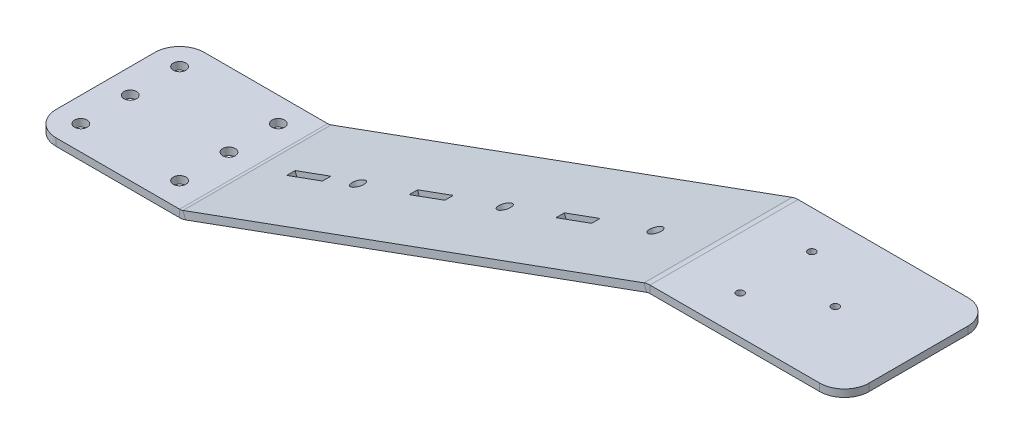
from build123d import *

# Parameters (mm, degrees)
SKETCH1_W          = 60
SKETCH1_H          = 60
BASE_FLANGE1_DEPTH = 3
EDGE_FLANGE1_DEPTH = 60
EDGE_FLANGE2_DEPTH = 60
FILLET1_R          = 10
SKETCH12_R         = 2.55
CUT_EXTRUDE1_DEPTH = 10
CAVITY1_START      = -1.5
CAVITY1_DEPTH      = 3
SKETCH15_W         = 15.4
SKETCH15_H         = 3.400000894
SKETCH15_H_2       = 3.4
CUT_EXTRUDE3_DEPTH = 3
SKETCH16_R         = 1.5
CUT_EXTRUDE4_DEPTH = 3
SKETCH17_R         = 2.55
CUT_EXTRUDE5_DEPTH = 10


# Read off the part's stored shape, not the designer's step: Cavity1
# Sheet-metal steps are written as plain solids
with BuildPart() as part:
    # Sketch1 → Base-Flange1 (new body)
    with BuildSketch(Plane(origin=(0, 0, 0), x_dir=(1, 0, 0), z_dir=(0, 1, 0))):
        Rectangle(SKETCH1_W, SKETCH1_H)
    extrude(amount=-BASE_FLANGE1_DEPTH)

    # Edge-Flange1 section (across the edge) → Edge-Flange1 (add)
    with BuildSketch(Plane(origin=(30.705307923, 0, 30), x_dir=(-0.3420201433256631, 0.9396926207859105, 0), z_dir=(0, 0, -1))):
        with BuildLine():
            Line((-3, 0.705307923), (-3, 199.471019058))
            Line((-3, 199.471019058), (0, 199.471019058))
            Line((0, 199.471019058), (0, 0.705307923))
            ThreePointArc((0, 0.705307923), (0.060768988, 0.010715212), (0.241229517, -0.66277265))
            Line((0.241229517, -0.66277265), (-2.577848346, -1.68883308))
            ThreePointArc((-2.577848346, -1.68883308), (-2.893654271, -0.510229321), (-3, 0.705307923))
        make_face()
    extrude(amount=EDGE_FLANGE1_DEPTH)

    # Edge-Flange2 section (across the edge) → Edge-Flange2 (add)
    with BuildSketch(Plane(origin=(219.835585673, 65.645258182, -30), x_dir=(0, -1, 0), z_dir=(0, 0, 1))):
        with BuildLine():
            Line((-3, 0.705307923), (-3, 79.471019058))
            Line((-3, 79.471019058), (0, 79.471019058))
            Line((0, 79.471019058), (0, 0.705307923))
            ThreePointArc((0, 0.705307923), (0.060768988, 0.010715212), (0.241229517, -0.66277265))
            Line((0.241229517, -0.66277265), (-2.577848346, -1.68883308))
            ThreePointArc((-2.577848346, -1.68883308), (-2.893654271, -0.510229321), (-3, 0.705307923))
        make_face()
    extrude(amount=EDGE_FLANGE2_DEPTH)

    # Fillet1
    fillet1_edges = [part.edges().sort_by_distance(p)[0] for p in [
        (299.30660473, 67.145258182, -30),
        (299.30660473, 67.145258182, 30),
        (-30, -1.5, 30),
        (-30, -1.5, -30),
    ]]
    fillet(fillet1_edges, radius=FILLET1_R)

    # Sketch12 → Cut-Extrude1 (cut)
    with BuildSketch(Plane(origin=(0, 0, 0), x_dir=(1, 0, 0), z_dir=(0, 1, 0))):
        with Locations(Location((20, 20, 0), (0, 0, 270))):
            Circle(SKETCH12_R)
        with Locations(Location((20, -20, 0), (0, 0, 270))):
            Circle(SKETCH12_R)
        with Locations(Location((-20, -20, 0), (0, 0, 270))):
            Circle(SKETCH12_R)
        with Locations(Location((-20, 20, 0), (0, 0, 270))):
            Circle(SKETCH12_R)
        with Locations(Location((-20, 0, 0), (0, 0, 270))):
            Circle(SKETCH12_R)
        with Locations(Location((20, 0, 0), (0, 0, 270))):
            Circle(SKETCH12_R)
    extrude(amount=-CUT_EXTRUDE1_DEPTH, mode=Mode.SUBTRACT)

    # Cavity1 outline → Cavity1 (cut)
    with BuildSketch(Plane.XY.offset(CAVITY1_START)):
        with BuildLine():
            ThreePointArc((167.585662257, 46.627841316), (168.714237544, 47.661990034), (168.781007212, 49.191266844))
            Line((168.781007212, 49.191266844), (168.438987069, 50.130959465))
            Line((168.438987069, 50.130959465), (154.343597757, 45.000657315))
            Line((154.343597757, 45.000657315), (154.6856179, 44.060964694))
            ThreePointArc((154.6856179, 44.060964694), (155.719766618, 42.932389407), (157.249043428, 42.865619739))
            Line((157.249043428, 42.865619739), (167.585662257, 46.627841316))
        make_face()
        with BuildLine():
            Line((109.317258169, 27.548232175), (108.975238025, 28.487924795))
            Line((108.975238025, 28.487924795), (94.879848713, 23.357622645))
            Line((94.879848713, 23.357622645), (95.221868857, 22.417930025))
            ThreePointArc((95.221868857, 22.417930025), (96.256017575, 21.289354737), (97.785294385, 21.22258507))
            Line((97.785294385, 21.22258507), (108.121913214, 24.984806646))
            ThreePointArc((108.121913214, 24.984806646), (109.250488501, 26.018955365), (109.317258169, 27.548232175))
        make_face()
        with BuildLine():
            Line((59.726286316, 9.498594532), (59.384266173, 10.438287153))
            Line((59.384266173, 10.438287153), (45.288876861, 5.307985003))
            Line((45.288876861, 5.307985003), (45.630897004, 4.368292382))
            ThreePointArc((45.630897004, 4.368292382), (46.665045723, 3.239717095), (48.194322533, 3.172947427))
            Line((48.194322533, 3.172947427), (58.530941361, 6.935169004))
            ThreePointArc((58.530941361, 6.935169004), (59.659516649, 7.969317722), (59.726286316, 9.498594532))
        make_face()
    extrude(amount=CAVITY1_DEPTH, mode=Mode.SUBTRACT)

    # Sketch15 → Cut-Extrude3 (cut)
    with BuildSketch(Plane(origin=(3.591838707, -9.868495742, 0), x_dir=(0.9396926207859104, 0.34202014332566316, 0), z_dir=(-0.34202014332566316, 0.9396926207859104, 0))):
        with Locations((104.646671142, 0)):
            Rectangle(SKETCH15_W, SKETCH15_H)
        with Locations((51.873061181, 0)):
            Rectangle(SKETCH15_W, SKETCH15_H)
        with Locations((167.926671142, 0)):
            Rectangle(SKETCH15_W, SKETCH15_H_2)
    extrude(amount=-CUT_EXTRUDE3_DEPTH, mode=Mode.SUBTRACT)

    # Sketch16 → Cut-Extrude4 (cut)
    with BuildSketch(Plane(origin=(0, 68.645258182, 0), x_dir=(1, 0, 0), z_dir=(0, 1, 0))):
        with Locations(Location((265.60660473, 0, 0), (0, 0, 270))):
            Circle(SKETCH16_R)
        with Locations(Location((241.60660473, 14.5, 0), (0, 0, 270))):
            Circle(SKETCH16_R)
        with Locations(Location((241.60660473, -14.5, 0), (0, 0, 270))):
            Circle(SKETCH16_R)
    extrude(amount=-CUT_EXTRUDE4_DEPTH, mode=Mode.SUBTRACT)

    # Sketch17 → Cut-Extrude5 (cut)
    with BuildSketch(Plane(origin=(3.591838707, -9.868495742, 0), x_dir=(0.9396926207859104, 0.34202014332566316, 0), z_dir=(-0.34202014332566316, 0.9396926207859104, 0))):
        with Locations(Location((136.324570332, 0, 0), (0, 0, 180))):
            Circle(SKETCH17_R)
        with Locations(Location((201.324570332, 0, 0), (0, 0, 180))):
            Circle(SKETCH17_R)
        with Locations(Location((73.074570332, 0, 0), (0, 0, 180))):
            Circle(SKETCH17_R)
    extrude(amount=-CUT_EXTRUDE5_DEPTH, mode=Mode.SUBTRACT)


solid = part.part
